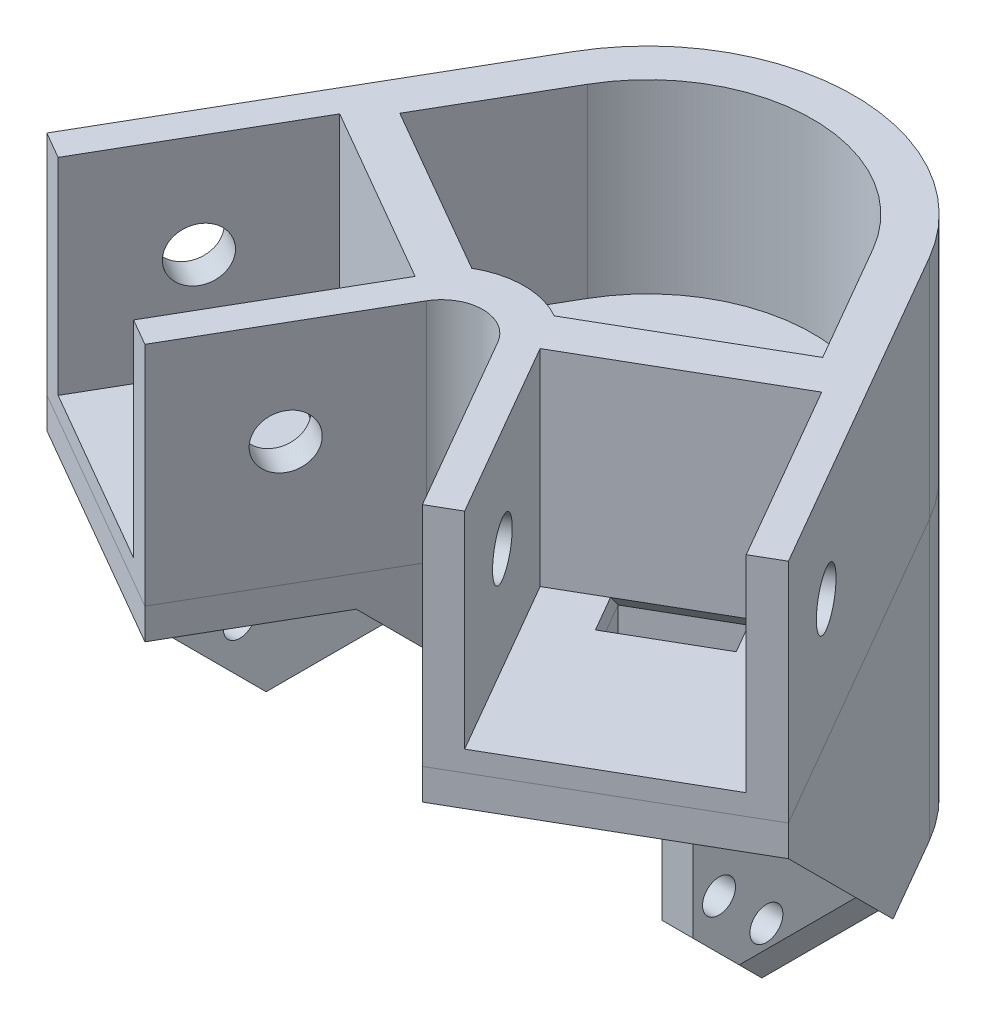
from build123d import *
from OCP.BRepFilletAPI import BRepFilletAPI_MakeChamfer

# Parameters (mm, degrees)
AUFSATZ_LINEAR_AUSTRAGEN1_DEPTH             = 2
AUFSATZ_LINEAR_AUSTRAGEN2_DEPTH             = 20
SCHNITT_LINEAR_AUSTRAGEN1_DEPTH             = 2
FASE2_SIZE                                  = 2
FASE3_SIZE                                  = 2
SCHALE1_START                               = 4
SCHALE1_DEPTH                               = 18
AUFSATZ_LINEAR_AUSTRAGEN5_DEPTH             = 3
SKIZZE17_R                                  = 1.6
SCHNITT_LINEAR_AUSTRAGEN2_DEPTH             = 4
SCHNITT_LINEAR_AUSTRAGEN3_DEPTH             = 3
AUFSATZ_LINEAR_START                        = 32
AUFSATZ_LINEAR_AUSTRAGEN7_DEPTH             = 32
FASE5_SIZE                                  = 32
FASE6_SIZE                                  = 8
AUFSATZ_LINEAR_AUSTRAGEN8_DEPTH             = 8
FASE7_SIZE                                  = 8
FASE8_SIZE                                  = 3.025
FASE8_SIZE_2                                = 8
SKIZZE19_R                                  = 1.6
AUFSATZ_LINEAR_AUSTRAGEN9_DEPTH             = 3
SCHNITT_LINEAR_AUSTRAGEN4_REACH             = 73.987
SKIZZE20_R                                  = 2.6
SCHNITT_LINEAR_AUSTRAGEN4_DIRECTION_2_REACH = 73.987
SCHNITT_LINEAR_AUSTRAGEN5_REACH             = 73.987
SKIZZE21_R                                  = 2.6
SCHNITT_LINEAR_AUSTRAGEN5_DIRECTION_2_REACH = 73.987
SCHNITT_LINEAR_AUSTRAGEN6_REACH             = 89.352
SKIZZE22_R                                  = 1.6


# Read off the part's stored shape, not the designer's step: Schale1
# Some blends are built 0.0001 mm under size
with BuildPart() as part:
    # Skizze1 → Aufsatz-Linear austragen1 (new body)
    with BuildSketch(Plane(origin=(0, 0, 0), x_dir=(1, 0, 0), z_dir=(0, 1, 0))):
        with BuildLine():
            Line((-35.980762114, -36.320508076), (-13.464101615, -49.320508076))
            Line((-13.464101615, -49.320508076), (-3.464101615, -32))
            ThreePointArc((-3.464101615, -32), (0, -30), (3.464101615, -32))
            Line((3.464101615, -32), (13.464101615, -49.320508076))
            Line((13.464101615, -49.320508076), (35.980762114, -36.320508076))
            Line((35.980762114, -36.320508076), (17.320508076, -4))
            ThreePointArc((17.320508076, -4), (0, 6), (-17.320508076, -4))
            Line((-17.320508076, -4), (-35.980762114, -36.320508076))
        make_face()
    extrude(amount=AUFSATZ_LINEAR_AUSTRAGEN1_DEPTH)

    # Skizze2 → Aufsatz-Linear austragen2 (add)
    # profile 1 of 2: a face of its own
    with BuildSketch(Plane(origin=(0, 2, 0), x_dir=(1, 0, 0), z_dir=(0, 1, 0))):
        with BuildLine():
            Line((-6.062177826, -30.5), (-16.062177826, -47.820508076))
            Line((-16.062177826, -47.820508076), (-13.464101615, -49.320508076))
            Line((-13.464101615, -49.320508076), (-3.464101615, -32))
            ThreePointArc((-3.464101615, -32), (0, -30), (3.464101615, -32))
            Line((3.464101615, -32), (13.464101615, -49.320508076))
            Line((13.464101615, -49.320508076), (16.062177826, -47.820508076))
            Line((16.062177826, -47.820508076), (6.062177826, -30.5))
            Line((6.062177826, -30.5), (23.382685902, -20.5))
            Line((23.382685902, -20.5), (33.382685902, -37.820508076))
            Line((33.382685902, -37.820508076), (35.980762114, -36.320508076))
            Line((35.980762114, -36.320508076), (17.320508076, -4))
            ThreePointArc((17.320508076, -4), (0, 6), (-17.320508076, -4))
            Line((-17.320508076, -4), (-35.980762114, -36.320508076))
            Line((-35.980762114, -36.320508076), (-33.382685902, -37.820508076))
            Line((-33.382685902, -37.820508076), (-23.382685902, -20.5))
            Line((-23.382685902, -20.5), (-6.062177826, -30.5))
        make_face()
        with BuildLine():
            Line((-5.062177826, -28.767949192), (-22.382685902, -18.767949192))
            Line((-22.382685902, -18.767949192), (-14.722431864, -5.5))
            ThreePointArc((-14.722431864, -5.5), (0, 3), (14.722431864, -5.5))
            Line((14.722431864, -5.5), (22.382685902, -18.767949192))
            Line((22.382685902, -18.767949192), (5.062177826, -28.767949192))
            ThreePointArc((5.062177826, -28.767949192), (0, -26.719890111), (-5.062177826, -28.767949192))
        make_face(mode=Mode.SUBTRACT)
    # profile 2 of 2: a face of its own
    with BuildSketch(Plane(origin=(0, 2, 0), x_dir=(1, 0, 0), z_dir=(0, 1, 0))):
        with BuildLine():
            Line((-14.722431864, -5.5), (-22.382685902, -18.767949192))
            Line((-22.382685902, -18.767949192), (-5.062177826, -28.767949192))
            ThreePointArc((-5.062177826, -28.767949192), (0, -26.719890111), (5.062177826, -28.767949192))
            Line((5.062177826, -28.767949192), (22.382685902, -18.767949192))
            Line((22.382685902, -18.767949192), (14.722431864, -5.5))
            ThreePointArc((14.722431864, -5.5), (0, 3), (-14.722431864, -5.5))
        make_face()
    extrude(amount=AUFSATZ_LINEAR_AUSTRAGEN2_DEPTH)

    # Skizze7 → Schnitt-Linear austragen1 (cut)
    with BuildSketch(Plane(origin=(0, 2, 0), x_dir=(1, 0, 0), z_dir=(0, 1, 0))):
        Polygon((-18.052558883, -21.267949192), (-20.052558883, -24.732050808), (-11.392304845, -29.732050808), (-9.392304845, -26.267949192), align=None)
        Polygon((9.392304845, -26.267949192), (11.392304845, -29.732050808), (20.052558883, -24.732050808), (18.052558883, -21.267949192), align=None)
    extrude(amount=-SCHNITT_LINEAR_AUSTRAGEN1_DEPTH, mode=Mode.SUBTRACT)

    # Fase2
    fase2_edges = [part.edges().sort_by_distance(p)[0] for p in [
        (13.722431864, 2, 23.767949192),
        (-13.722431864, 2, 23.767949192),
    ]]
    chamfer(fase2_edges, length=FASE2_SIZE - 0.0001)  # a hair under: the kernel refuses the full size

    # Fase3
    fase3_edges = [part.edges().sort_by_distance(p)[0] for p in [
        (-15.722431864, 2, 27.232050808),
        (15.722431864, 2, 27.232050808),
    ]]
    chamfer(fase3_edges, length=FASE3_SIZE - 0.0001)  # a hair under: the kernel refuses the full size

    # Schale1 outline → Schale1 (cut)
    with BuildSketch(Plane(origin=(0, 0, 0), x_dir=(1, 0, 0), z_dir=(0, 1, 0)).offset(SCHALE1_START)):
        with BuildLine():
            Line((-13.856406461, -6), (-20.516660498, -17.535898385))
            Line((-20.516660498, -17.535898385), (-4, -27.07179677))
            ThreePointArc((-4, -27.07179677), (0, -26), (4, -27.07179677))
            Line((4, -27.07179677), (20.516660498, -17.535898385))
            Line((20.516660498, -17.535898385), (13.856406461, -6))
            ThreePointArc((13.856406461, -6), (0, 2), (-13.856406461, -6))
        make_face()
    extrude(amount=SCHALE1_DEPTH, mode=Mode.SUBTRACT)

    # Skizze17 → Schnitt-Linear austragen2 (cut)
    with BuildSketch(Plane(origin=(0, 4, 0), x_dir=(1, 0, 0), z_dir=(0, 1, 0))):
        with Locations(Location((-7, -7, 0), (0, 0, 270))):
            Circle(SKIZZE17_R)
        with Locations(Location((-7, -17, 0), (0, 0, 270))):
            Circle(SKIZZE17_R)
        with Locations(Location((7, -17, 0), (0, 0, 90))):
            Circle(SKIZZE17_R)
        with Locations(Location((7, -7, 0), (0, 0, 90))):
            Circle(SKIZZE17_R)
    extrude(amount=-SCHNITT_LINEAR_AUSTRAGEN2_DEPTH, mode=Mode.SUBTRACT)

    # Schnitt-Linear austragen4: up to this face of the body (flat: up to its plane)
    schnitt_linear_austragen4_end = Plane(part.part.faces().sort_by_distance((8.464101615, 11, 40.660254038))[0])
    # Skizze20 → Schnitt-Linear austragen4 (cut, up to the picked face)
    with BuildSketch(Plane(origin=(-8.660254038, 0, 5), x_dir=(-0.5, 0, -0.8660254037844386), z_dir=(0.8660254037844387, 0, -0.5000000000000001)), mode=Mode.PRIVATE) as schnitt_linear_austragen4_sk1:
        with Locations(Location((-39.444863729, 12, 0), (0, 0, 180))):
            Circle(SKIZZE20_R)
    schnitt_linear_austragen4_tool1 = split(extrude(schnitt_linear_austragen4_sk1.sketch, amount=-SCHNITT_LINEAR_AUSTRAGEN4_REACH, mode=Mode.PRIVATE), bisect_by=schnitt_linear_austragen4_end, keep=Keep.BOTH, mode=Mode.PRIVATE)
    add(schnitt_linear_austragen4_tool1.solids().sort_by(Axis((11.062178, 12, 39.160254), (-0.8660254037844387, 0, 0.5000000000000001)))[0], mode=Mode.SUBTRACT)

    # Skizze20 → Schnitt-Linear austragen4 direction 2 (cut, up to next)
    with BuildSketch(Plane(origin=(-8.660254038, 0, 5), x_dir=(-0.5, 0, -0.8660254037844386), z_dir=(0.8660254037844387, 0, -0.5000000000000001)), mode=Mode.PRIVATE) as schnitt_linear_austragen4_direction_2_sk1:
        with Locations(Location((-39.444863729, 12, 0), (0, 0, 180))):
            Circle(SKIZZE20_R)
    schnitt_linear_austragen4_direction_2_tool1 = extrude(schnitt_linear_austragen4_direction_2_sk1.sketch, amount=SCHNITT_LINEAR_AUSTRAGEN4_DIRECTION_2_REACH, mode=Mode.PRIVATE) & part.part
    add(schnitt_linear_austragen4_direction_2_tool1.solids().sort_by_distance((11.062178, 12, 39.160254))[0], mode=Mode.SUBTRACT)

    # Schnitt-Linear austragen5: up to this face of the body (flat: up to its plane)
    schnitt_linear_austragen5_end = Plane(part.part.faces().sort_by_distance((-8.464101615, 11, 40.660254038))[0])
    # Skizze21 → Schnitt-Linear austragen5 (cut, up to the picked face)
    with BuildSketch(Plane(origin=(8.660254038, 0, 5), x_dir=(-0.5, 0, 0.8660254037844386), z_dir=(-0.8660254037844387, 0, -0.5000000000000001)), mode=Mode.PRIVATE) as schnitt_linear_austragen5_sk1:
        with Locations(Location((39.444863729, 12, 0), (0, 0, 180))):
            Circle(SKIZZE21_R)
    schnitt_linear_austragen5_tool1 = split(extrude(schnitt_linear_austragen5_sk1.sketch, amount=-SCHNITT_LINEAR_AUSTRAGEN5_REACH, mode=Mode.PRIVATE), bisect_by=schnitt_linear_austragen5_end, keep=Keep.BOTH, mode=Mode.PRIVATE)
    add(schnitt_linear_austragen5_tool1.solids().sort_by(Axis((-11.062178, 12, 39.160254), (0.8660254037844387, 0, 0.5000000000000001)))[0], mode=Mode.SUBTRACT)

    # Skizze21 → Schnitt-Linear austragen5 direction 2 (cut, up to next)
    with BuildSketch(Plane(origin=(8.660254038, 0, 5), x_dir=(-0.5, 0, 0.8660254037844386), z_dir=(-0.8660254037844387, 0, -0.5000000000000001)), mode=Mode.PRIVATE) as schnitt_linear_austragen5_direction_2_sk1:
        with Locations(Location((39.444863729, 12, 0), (0, 0, 180))):
            Circle(SKIZZE21_R)
    schnitt_linear_austragen5_direction_2_tool1 = extrude(schnitt_linear_austragen5_direction_2_sk1.sketch, amount=SCHNITT_LINEAR_AUSTRAGEN5_DIRECTION_2_REACH, mode=Mode.PRIVATE) & part.part
    add(schnitt_linear_austragen5_direction_2_tool1.solids().sort_by_distance((-11.062178, 12, 39.160254))[0], mode=Mode.SUBTRACT)


with BuildPart() as body_2:
    # Skizze12 → Aufsatz-Linear austragen5 (new body)
    with BuildSketch(Plane.XZ):
        with BuildLine():
            Line((-1, 31), (1, 31))
            Line((1, 31), (1.645751311, 30.354248689))
            ThreePointArc((1.645751311, 30.354248689), (2.684170929, 31.0343253), (3.464101615, 32))
            Line((3.464101615, 32), (13.464101615, 49.320508076))
            Line((13.464101615, 49.320508076), (35.980762114, 36.320508076))
            Line((35.980762114, 36.320508076), (17.320508076, 4))
            ThreePointArc((17.320508076, 4), (0, -6), (-17.320508076, 4))
            Line((-17.320508076, 4), (-35.980762114, 36.320508076))
            Line((-35.980762114, 36.320508076), (-13.464101615, 49.320508076))
            Line((-13.464101615, 49.320508076), (-3.464101615, 32))
            ThreePointArc((-3.464101615, 32), (-2.684170929, 31.0343253), (-1.645751311, 30.354248689))
            Line((-1.645751311, 30.354248689), (-1, 31))
        make_face()
        Polygon((18.052558883, 21.267949192), (9.392304845, 26.267949192), (11.392304845, 29.732050808), (20.052558883, 24.732050808), align=None, mode=Mode.SUBTRACT)
        Polygon((-11.392304845, 29.732050808), (-9.392304845, 26.267949192), (-18.052558883, 21.267949192), (-20.052558883, 24.732050808), align=None, mode=Mode.SUBTRACT)
    extrude(amount=AUFSATZ_LINEAR_AUSTRAGEN5_DEPTH)

    # Skizze18 → Schnitt-Linear austragen3 (cut)
    with BuildSketch(Plane.XZ.offset(3)):
        Polygon((-3.496895497, 14.977481672), (-3.496895497, 19.022518328), (-7, 21.045036655), (-10.503104503, 19.022518328), (-10.503104503, 14.977481672), (-7, 12.954963345), align=None)
        Polygon((-3.496895497, 9.022518328), (-7, 11.045036655), (-10.503104503, 9.022518328), (-10.503104503, 4.977481672), (-7, 2.954963345), (-3.496895497, 4.977481672), align=None)
        Polygon((10.503104503, 9.022518328), (7, 11.045036655), (3.496895497, 9.022518328), (3.496895497, 4.977481672), (7, 2.954963345), (10.503104503, 4.977481672), align=None)
        Polygon((10.503104503, 19.022518328), (7, 21.045036655), (3.496895497, 19.022518328), (3.496895497, 14.977481672), (7, 12.954963345), (10.503104503, 14.977481672), align=None)
    extrude(amount=-SCHNITT_LINEAR_AUSTRAGEN3_DEPTH, mode=Mode.SUBTRACT)

    # Skizze15 → Aufsatz-Linear austragen7 (add)
    with BuildSketch(Plane.XZ.offset(3).offset(AUFSATZ_LINEAR_START)):
        with BuildLine():
            Line((-5.958548116, 36.320508076), (-11.392304845, 36.320508076))
            Line((-11.392304845, 36.320508076), (-11.392304845, 29.732050808))
            Line((-11.392304845, 29.732050808), (-9.392304845, 26.267949192))
            Line((-9.392304845, 26.267949192), (-18.052558883, 21.267949192))
            Line((-18.052558883, 21.267949192), (-20.052558883, 24.732050808))
            Line((-20.052558883, 24.732050808), (-20.052558883, 36.320508076))
            Line((-20.052558883, 36.320508076), (-35.980762114, 36.320508076))
            Line((-35.980762114, 36.320508076), (-17.320508076, 4))
            ThreePointArc((-17.320508076, 4), (0, -6), (17.320508076, 4))
            Line((17.320508076, 4), (35.980762114, 36.320508076))
            Line((35.980762114, 36.320508076), (20.052558883, 36.320508076))
            Line((20.052558883, 36.320508076), (20.052558883, 24.732050808))
            Line((20.052558883, 24.732050808), (18.052558883, 21.267949192))
            Line((18.052558883, 21.267949192), (9.392304845, 26.267949192))
            Line((9.392304845, 26.267949192), (11.392304845, 29.732050808))
            Line((11.392304845, 29.732050808), (11.392304845, 36.320508076))
            Line((11.392304845, 36.320508076), (5.958548116, 36.320508076))
            Line((5.958548116, 36.320508076), (3.464101615, 32))
            ThreePointArc((3.464101615, 32), (2.684170929, 31.0343253), (1.645751311, 30.354248689))
            Line((1.645751311, 30.354248689), (1, 31))
            Line((1, 31), (-1, 31))
            Line((-1, 31), (-1.645751311, 30.354248689))
            ThreePointArc((-1.645751311, 30.354248689), (-2.684170929, 31.0343253), (-3.464101615, 32))
            Line((-3.464101615, 32), (-5.958548116, 36.320508076))
        make_face()
        Polygon((-10.503104503, 14.977481672), (-7, 12.954963345), (-3.496895497, 14.977481672), (-3.496895497, 19.022518328), (-7, 21.045036655), (-10.503104503, 19.022518328), align=None, mode=Mode.SUBTRACT)
        Polygon((7, 12.954963345), (10.503104503, 14.977481672), (10.503104503, 19.022518328), (7, 21.045036655), (3.496895497, 19.022518328), (3.496895497, 14.977481672), align=None, mode=Mode.SUBTRACT)
        Polygon((7, 2.954963345), (10.503104503, 4.977481672), (10.503104503, 9.022518328), (7, 11.045036655), (3.496895497, 9.022518328), (3.496895497, 4.977481672), align=None, mode=Mode.SUBTRACT)
        Polygon((-7, 2.954963345), (-3.496895497, 4.977481672), (-3.496895497, 9.022518328), (-7, 11.045036655), (-10.503104503, 9.022518328), (-10.503104503, 4.977481672), align=None, mode=Mode.SUBTRACT)
    extrude(amount=-AUFSATZ_LINEAR_AUSTRAGEN7_DEPTH)

    # Fase5
    # the kernel refuses this chamfer: 32 mm, written as the material it takes off along each edge
    with BuildSketch(Plane(origin=(118.274617728, -35, 36.320508076), x_dir=(0, 0.9996219169112968, 0.027495876610586275), z_dir=(-1, 0, 0))) as fase5_piece_1_section:
        Polygon((FASE5_SIZE * 0.999621916911, FASE5_SIZE * 0.0274958766106), (-FASE5_SIZE * 0.0274958766106, FASE5_SIZE * 0.999621916911), (0, 0), align=None)
    fase5_piece_1 = extrude(amount=180.51591446, mode=Mode.PRIVATE)
    fase5_piece_1 = split(fase5_piece_1, bisect_by=Plane(origin=(28.016660498, -3, 25.747575137), z_dir=(0, -1, 0)), keep=Keep.TOP, mode=Mode.PRIVATE)
    add(fase5_piece_1, mode=Mode.SUBTRACT)

    # Fase6
    # the kernel refuses this chamfer: 8 mm, written as the material it takes off along each edge
    with BuildSketch(Plane(origin=(-27.792285451, -35, 22.13765046), x_dir=(-0.02381212764409023, 0.9996219169112968, -0.013747938305293222), z_dir=(0.5, 0, -0.8660254037844387)), Plane(origin=(17.320508076, -35, 4), x_dir=(0.023812127644090207, 0.9996219169112968, -0.013747938305293205), z_dir=(0.4999999999999999, 0, 0.8660254037844388))) as fase6_piece_1:
        Polygon((FASE6_SIZE * 0.999621916911, FASE6_SIZE * 0.0274958766106), (-FASE6_SIZE * 0.0274958766106, FASE6_SIZE * 0.999621916911), (0, 0), align=None)
    extrude(amount=20.943554751, mode=Mode.SUBTRACT)
    with BuildSketch(Plane(origin=(0, -35, 14), x_dir=(-0.8660254037844384, 0, -0.5000000000000004), z_dir=(-0.5000000000000004, 0, 0.8660254037844384))) as fase6_piece_2:
        Polygon((20, -FASE6_SIZE), (20 - FASE6_SIZE, 0), (20, 0), align=None)
    revolve(axis=Axis((0, -35, 14), (0, -1, 0)), revolution_arc=120, mode=Mode.SUBTRACT)

    # Skizze16 → Aufsatz-Linear austragen8 (add)
    with BuildSketch(Plane(origin=(0, -19.660254038, 19.660254038), x_dir=(1, 0, 0), z_dir=(0, -0.7071067811865477, 0.7071067811865475))):
        Polygon((-27.05, 1.685347021), (-27.05, 16.036822534), (-24.05, 16.036822534), (-24.05, -5.663122208), align=None)
        Polygon((27.05, 1.685347021), (27.05, 16.036822534), (24.05, 16.036822534), (24.05, -5.663122208), align=None)
    extrude(amount=AUFSATZ_LINEAR_AUSTRAGEN8_DEPTH)

    # Fase7
    # the kernel refuses this chamfer: 8 mm, written as the material it adds along each edge
    with BuildSketch(Plane(origin=(-27.05, -8.320508076, 31), x_dir=(0, 0.726281956875323, 0.6873969152661011), z_dir=(1, 0, 0))) as fase7_piece_1_section:
        Polygon((FASE7_SIZE * 0.999621916911, FASE7_SIZE * 0.0274958766106), (-FASE7_SIZE * 0.0274958766086, FASE7_SIZE * 0.999621916911), (0, 0), align=None)
    fase7_piece_1 = extrude(amount=3, mode=Mode.PRIVATE)
    fase7_piece_1 = split(fase7_piece_1, bisect_by=Plane(origin=(-25.55, -12.108314181, 38.525902394), z_dir=(0, 0.7071067811865477, -0.7071067811865475)), keep=Keep.TOP, mode=Mode.PRIVATE)
    add(fase7_piece_1)
    with BuildSketch(Plane(origin=(27.05, -8.320508076, 31), x_dir=(0, 0.726281956875323, 0.6873969152661011), z_dir=(-1, 0, 0))) as fase7_piece_2_section:
        Polygon((FASE7_SIZE * 0.999621916911, -FASE7_SIZE * 0.0274958766106), (-FASE7_SIZE * 0.0274958766086, -FASE7_SIZE * 0.999621916911), (0, 0), align=None)
    fase7_piece_2 = extrude(amount=3, mode=Mode.PRIVATE)
    fase7_piece_2 = split(fase7_piece_2, bisect_by=Plane(origin=(25.55, -12.108314181, 38.525902394), z_dir=(0, 0.7071067811865477, -0.7071067811865475)), keep=Keep.TOP, mode=Mode.PRIVATE)
    add(fase7_piece_2)

    # Fase8
    fase8_edges_1 = [body_2.edges().sort_by_distance(p)[0] for p in [
        (25.55, -26.723464192, 23.910752383),
    ]]
    fase8_side_1 = [body_2.faces().sort_by_distance(p)[0] for p in [
        (25.493987884, -26.707294887, 23.926921688),
    ]]
    fase8_edges_2 = [body_2.edges().sort_by_distance(p)[0] for p in [
        (-25.55, -26.723464192, 23.910752383),
    ]]
    fase8_side_2 = [body_2.faces().sort_by_distance(p)[0] for p in [
        (-25.55, -26.680684232, 23.867972423),
    ]]
    fase8 = BRepFilletAPI_MakeChamfer(body_2.part.solid().wrapped)
    for e in fase8_edges_1:
        fase8.Add(FASE8_SIZE - 0.0001, FASE8_SIZE_2 - 0.0001, e.wrapped, fase8_side_1[0].wrapped)
    for e in fase8_edges_2:
        fase8.Add(FASE8_SIZE_2 - 0.0001, FASE8_SIZE - 0.0001, e.wrapped, fase8_side_2[0].wrapped)
    add(Compound.cast(fase8.Shape()), mode=Mode.REPLACE)  # a hair under: the kernel refuses the full size

    # Skizze19 → Aufsatz-Linear austragen9 (add)
    # profile 1 of 4: a face of its own
    with BuildSketch(Plane(origin=(0, 0, 0), x_dir=(1, 0, 0), z_dir=(0, 1, 0))):
        Polygon((10.503104503, -14.977481672), (7, -12.954963345), (3.496895497, -14.977481672), (3.496895497, -19.022518328), (7, -21.045036655), (10.503104503, -19.022518328), align=None)
        with Locations(Location((7, -17, 0), (0, 0, 270))):
            Circle(SKIZZE19_R, mode=Mode.SUBTRACT)
    # profile 2 of 4: a face of its own
    with BuildSketch(Plane(origin=(0, 0, 0), x_dir=(1, 0, 0), z_dir=(0, 1, 0))):
        Polygon((3.496895497, -9.022518328), (7, -11.045036655), (10.503104503, -9.022518328), (10.503104503, -4.977481672), (7, -2.954963345), (3.496895497, -4.977481672), align=None)
        with Locations(Location((7, -7, 0), (0, 0, 270))):
            Circle(SKIZZE19_R, mode=Mode.SUBTRACT)
    # profile 3 of 4: a face of its own
    with BuildSketch(Plane(origin=(0, 0, 0), x_dir=(1, 0, 0), z_dir=(0, 1, 0))):
        Polygon((-3.496895497, -9.022518328), (-3.496895497, -4.977481672), (-7, -2.954963345), (-10.503104503, -4.977481672), (-10.503104503, -9.022518328), (-7, -11.045036655), align=None)
        with Locations(Location((-7, -7, 0), (0, 0, 270))):
            Circle(SKIZZE19_R, mode=Mode.SUBTRACT)
    # profile 4 of 4: a face of its own
    with BuildSketch(Plane(origin=(0, 0, 0), x_dir=(1, 0, 0), z_dir=(0, 1, 0))):
        Polygon((-3.496895497, -14.977481672), (-7, -12.954963345), (-10.503104503, -14.977481672), (-10.503104503, -19.022518328), (-7, -21.045036655), (-3.496895497, -19.022518328), align=None)
        with Locations(Location((-7, -17, 0), (0, 0, 270))):
            Circle(SKIZZE19_R, mode=Mode.SUBTRACT)
    extrude(amount=-AUFSATZ_LINEAR_AUSTRAGEN9_DEPTH)

    # Schnitt-Linear austragen6: up to this face of the body (flat: up to its plane)
    schnitt_linear_austragen6_end = Plane(body_2.part.faces().sort_by_distance((27.05, -12.873295448, 31.054850836))[0])
    # Skizze22 → Schnitt-Linear austragen6 (cut, up to the picked face)
    with BuildSketch(Plane.ZY.offset(27.05), mode=Mode.PRIVATE) as schnitt_linear_austragen6_sk1:
        with Locations((29.532922489, -16.292967974)):
            Circle(SKIZZE22_R)
    schnitt_linear_austragen6_tool1 = split(extrude(schnitt_linear_austragen6_sk1.sketch, amount=-SCHNITT_LINEAR_AUSTRAGEN6_REACH, mode=Mode.PRIVATE), bisect_by=schnitt_linear_austragen6_end, keep=Keep.BOTH, mode=Mode.PRIVATE)
    # Skizze22 → Schnitt-Linear austragen6 (cut, up to the picked face)
    with BuildSketch(Plane.ZY.offset(27.05), mode=Mode.PRIVATE) as schnitt_linear_austragen6_sk2:
        with Locations((34.129116567, -11.696773896)):
            Circle(SKIZZE22_R)
    schnitt_linear_austragen6_tool2 = split(extrude(schnitt_linear_austragen6_sk2.sketch, amount=-SCHNITT_LINEAR_AUSTRAGEN6_REACH, mode=Mode.PRIVATE), bisect_by=schnitt_linear_austragen6_end, keep=Keep.BOTH, mode=Mode.PRIVATE)
    add(schnitt_linear_austragen6_tool1.solids().sort_by(Axis((-27.05, -16.292968, 29.532922), (1, 0, 0)))[0], mode=Mode.SUBTRACT)
    add(schnitt_linear_austragen6_tool2.solids().sort_by(Axis((-27.05, -11.696774, 34.129117), (1, 0, 0)))[0], mode=Mode.SUBTRACT)


solid = Compound([part.part, body_2.part])
